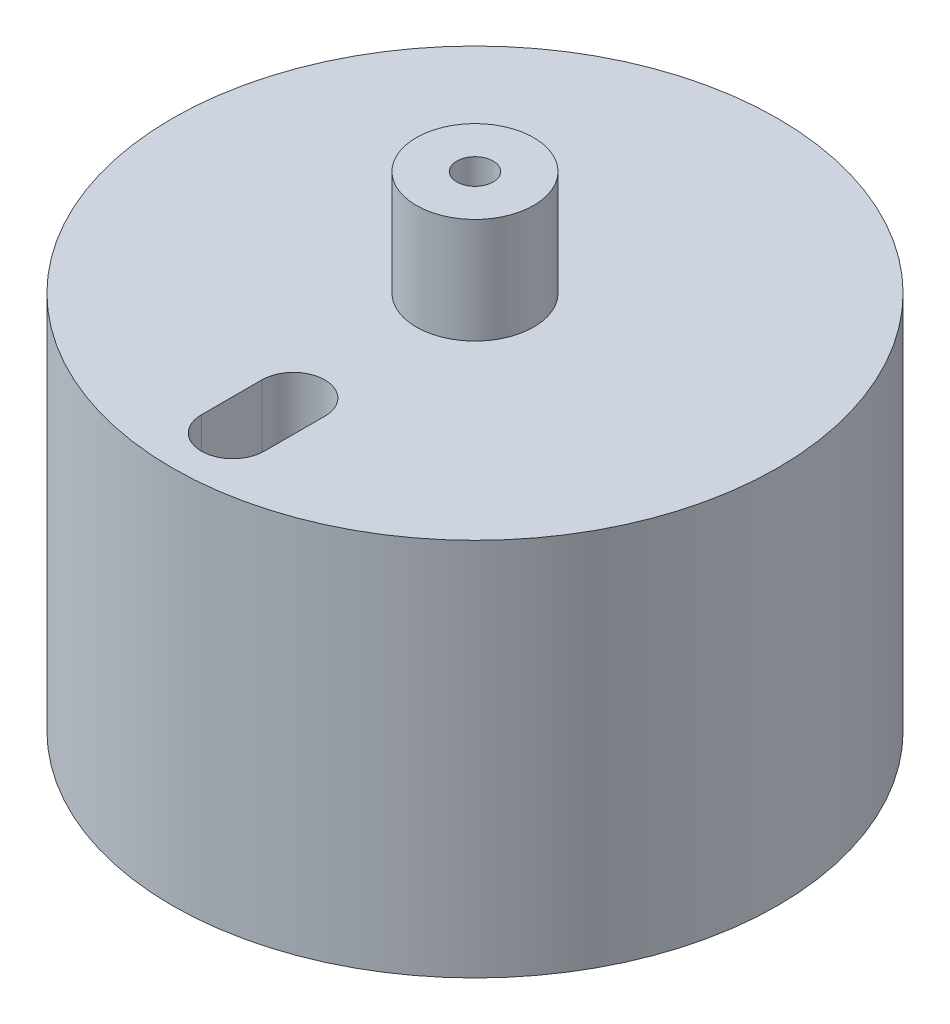
from build123d import *

# Parameters (mm, degrees)
SKETCH1_R           = 25
BOSS_EXTRUDE1_DEPTH = 40
CUT_EXTRUDE1_START  = -8.7
SKETCH2_R           = 25
SKETCH2_R_2         = 4.85
CUT_EXTRUDE1_DEPTH  = 8.7
CUT_EXTRUDE2_DEPTH  = 10
SKETCH5_R           = 1.5
CUT_EXTRUDE3_DEPTH  = 42.275779823
SKETCH6_R           = 1.5
CUT_EXTRUDE4_DEPTH  = 54.38539126


with BuildPart() as part:
    # Sketch1 → Boss-Extrude1 (new body)
    with BuildSketch(Plane(origin=(0, 0, 0), x_dir=(1, 0, 0), z_dir=(0, 1, 0))):
        Circle(SKETCH1_R)
    extrude(amount=BOSS_EXTRUDE1_DEPTH)

    # Sketch2 → Cut-Extrude1 (cut)
    with BuildSketch(Plane(origin=(0, 40, 0), x_dir=(1, 0, 0), z_dir=(0, 1, 0)).offset(CUT_EXTRUDE1_START)):
        Circle(SKETCH2_R)
        Circle(SKETCH2_R_2, mode=Mode.SUBTRACT)
    extrude(amount=CUT_EXTRUDE1_DEPTH, mode=Mode.SUBTRACT)

    # Sketch3 → Cut-Extrude2 (cut)
    with BuildSketch(Plane(origin=(0, 31.3, 0), x_dir=(1, 0, 0), z_dir=(0, 1, 0))):
        with BuildLine():
            Line((-2.6, -15), (-2.6, -20))
            ThreePointArc((-2.6, -20), (0, -22.6), (2.6, -20))
            Line((2.6, -20), (2.6, -15))
            ThreePointArc((2.6, -15), (0, -12.4), (-2.6, -15))
        make_face()
    extrude(amount=-CUT_EXTRUDE2_DEPTH, mode=Mode.SUBTRACT)

    # Sketch5 → Cut-Extrude3 (cut, through all)
    with BuildSketch(Plane(origin=(0, 21.3, 0), x_dir=(1, 0, 0), z_dir=(0, 1, 0))):
        with Locations((0, -17.5)):
            Circle(SKETCH5_R)
    extrude(amount=-CUT_EXTRUDE3_DEPTH, mode=Mode.SUBTRACT)

    # Sketch6 → Cut-Extrude4 (cut, through all)
    with BuildSketch(Plane.XZ):
        Circle(SKETCH6_R)
    extrude(amount=-CUT_EXTRUDE4_DEPTH, mode=Mode.SUBTRACT)


solid = part.part
